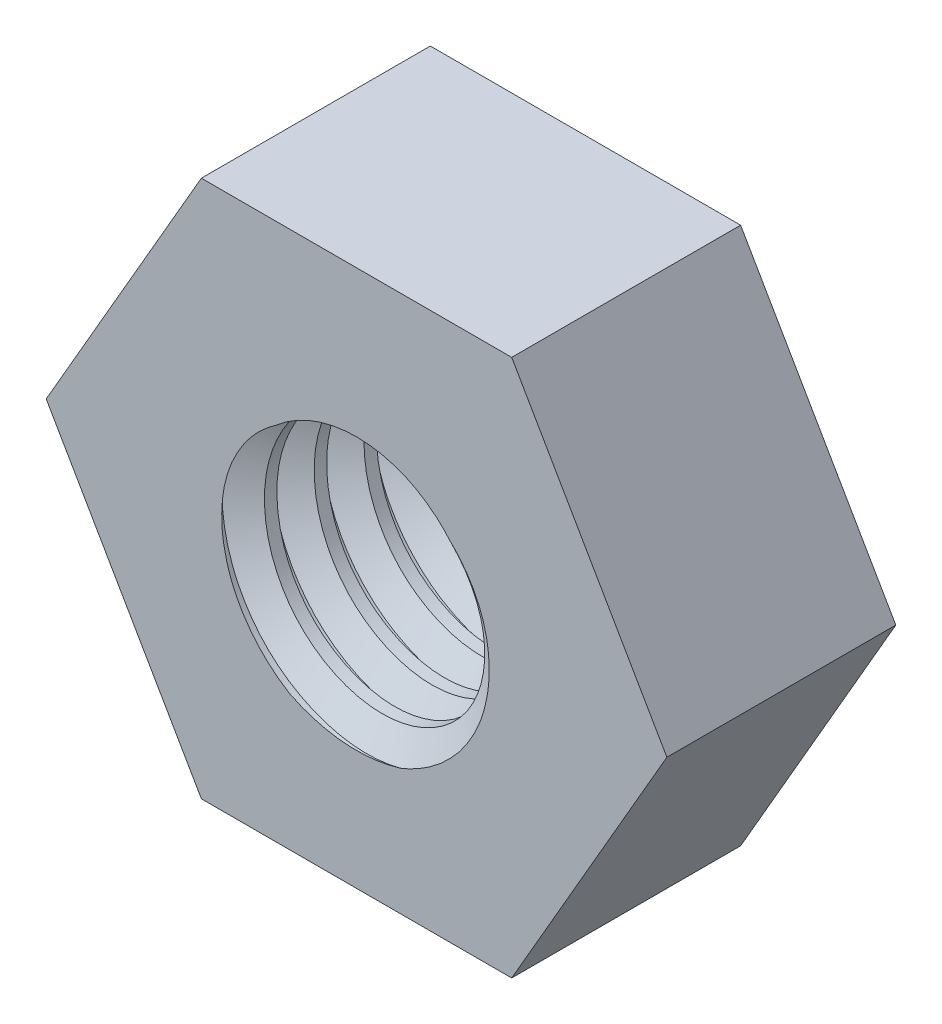
from build123d import *

# Parameters (mm, degrees)
RESSALTO_EXTRUS_O1_DEPTH      = 5
RESSALTO_EXTRUS_O1_DEPTH_BACK = 5
ESBO_O1_R                     = 1.5
ROSCA1_PITCH                  = 0.5
CORTE_EXTRUS_O1_DEPTH         = 7.481779569
CORTE_EXTRUS_O1_DEPTH_BACK    = 7.481779569
ESBO_O8_W                     = 6.235382908
ESBO_O8_H                     = 6.35


with BuildPart() as part:
    # Esboço1 → Ressalto-extrusão1 (new, two sides: drawn at the far end of the back side and taken through both)
    with BuildSketch(Plane.XY.offset(-RESSALTO_EXTRUS_O1_DEPTH_BACK)):
        Polygon((3.117691454, 0), (1.558845727, 2.7), (-1.558845727, 2.7), (-3.117691454, 0), (-1.558845727, -2.7), (1.558845727, -2.7), align=None)
        Circle(ESBO_O1_R, mode=Mode.SUBTRACT)
    extrude(amount=RESSALTO_EXTRUS_O1_DEPTH + RESSALTO_EXTRUS_O1_DEPTH_BACK)

    # Rosca1: the profile of Perfil da rosca2 profile screwed along a right-hand helix of 19.125 turns, 6 arcs to a turn; built about Z, then put on its axis
    rosca1_z = Axis((0, 0, 0), (0, 0, 1))
    rosca1_corners = [(1.5006, 0, -0.00034641), (1.5006, 0, 0.437846409), (1.229367063, 0, 0.281249999), (1.229367063, 0, 0.156249999)]
    with BuildLine(mode=Mode.PRIVATE) as rosca1_profile:
        Line(rosca1_corners[0], rosca1_corners[1])
        Line(rosca1_corners[1], rosca1_corners[2])
        Line(rosca1_corners[2], rosca1_corners[3])
        Line(rosca1_corners[3], rosca1_corners[0])
    rosca1_cap = Face(rosca1_profile.wire())
    rosca1_turn_angles = [0, 30, 60, 90, 120, 150, 180, 210, 240, 270, 300, 330, 360]
    rosca1_turn_weights = [1, 0.8660254037844387, 1, 0.8660254037844387, 1, 0.8660254037844387, 1, 0.8660254037844387, 1, 0.8660254037844387, 1, 0.8660254037844387, 1]
    rosca1_turn_rails = [Edge.make_bspline([Vector(p[0], p[1], 0).rotate(rosca1_z, rosca1_turn_angles[k]) / rosca1_turn_weights[k] + Vector(0, 0, p[2] + ROSCA1_PITCH * rosca1_turn_angles[k] / 360) for k in range(13)], [0, 0, 0, 1, 1, 2, 2, 3, 3, 4, 4, 5, 5, 6, 6, 6], 2, rosca1_turn_weights) for p in rosca1_corners]
    rosca1_turn_sides = [Face.make_surface_from_curves(rosca1_turn_rails[p[0]], rosca1_turn_rails[p[1]]) for p in [(0, 1), (1, 2), (2, 3), (3, 0)]]
    rosca1_last_angles = [6840, 6862.500000492, 6885.000000983]
    rosca1_last_weights = [1, 0.9238795292277565, 1]
    rosca1_last_rails = [Edge.make_bspline([Vector(p[0], p[1], 0).rotate(rosca1_z, rosca1_last_angles[k]) / rosca1_last_weights[k] + Vector(0, 0, p[2] + ROSCA1_PITCH * rosca1_last_angles[k] / 360) for k in range(3)], [0, 0, 0, 1, 1, 1], 2, rosca1_last_weights) for p in rosca1_corners]
    rosca1_last_sides = [Face.make_surface_from_curves(rosca1_last_rails[p[0]], rosca1_last_rails[p[1]]) for p in [(0, 1), (1, 2), (2, 3), (3, 0)]]
    rosca1 = Plane(origin=(0, 0, 5), x_dir=(-1, 0, 0), z_dir=(0, 0, -1)) * Solid(Shell([*[p.moved(Location((0, 0, ROSCA1_PITCH * i))) for i in range(19) for p in rosca1_turn_sides], *rosca1_last_sides, rosca1_cap, rosca1_cap.rotate(rosca1_z, 6885.000000983).moved(Location((0, 0, ROSCA1_PITCH * 6885.000000983 / 360)))]))
    add(rosca1)

    # Esboço8 → Corte-extrusão1 (cut, two sides: drawn at the far end of the back side and taken through both)
    with BuildSketch(Plane(origin=(0, 0, 0), x_dir=(1, 0, 0), z_dir=(0, 1, 0)).offset(-CORTE_EXTRUS_O1_DEPTH_BACK)):
        with Locations((0, 4.325)):
            Rectangle(ESBO_O8_W, ESBO_O8_H)
        with Locations((0, -4.325)):
            Rectangle(ESBO_O8_W, ESBO_O8_H)
    extrude(amount=CORTE_EXTRUS_O1_DEPTH + CORTE_EXTRUS_O1_DEPTH_BACK, mode=Mode.SUBTRACT)


solid = part.part
